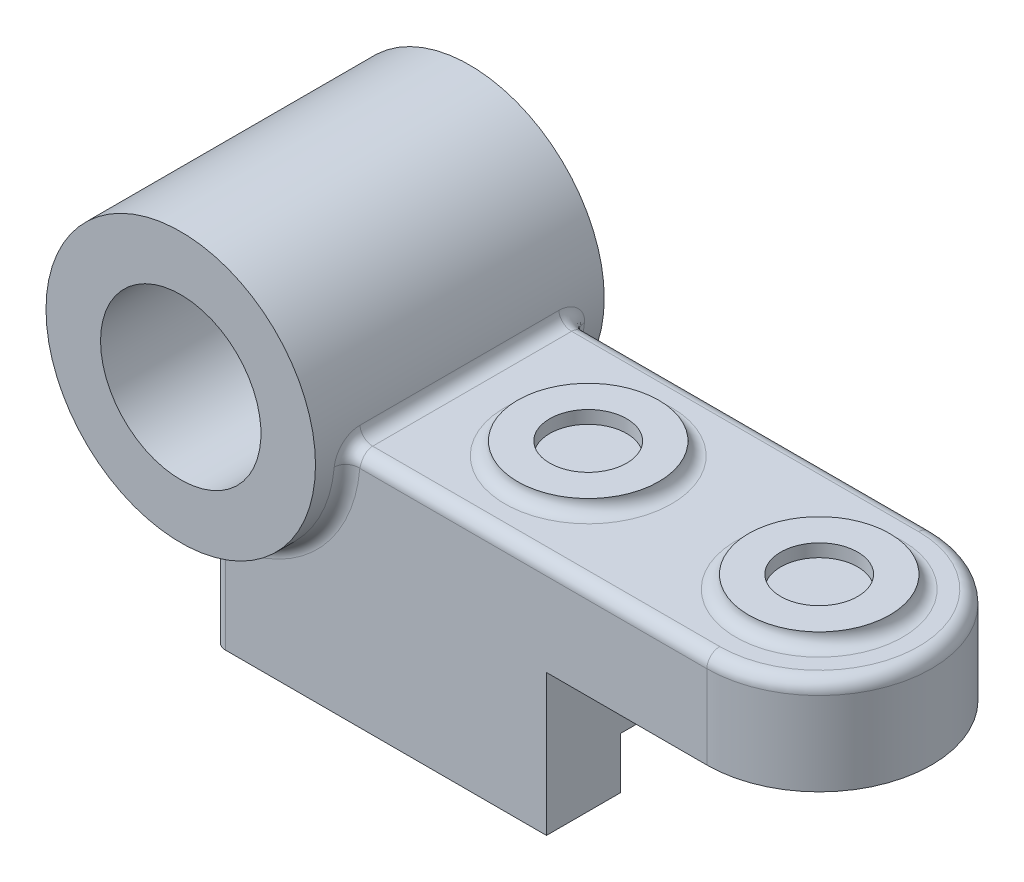
from build123d import *

# Parameters (mm, degrees)
SKETCH3_R               = 21
SKETCH3_R_2             = 12.5
BOSS_EXTRUDE1_DEPTH     = 22.5
BOSS_EXTRUDE2_DEPTH     = 17.5
CUT_EXTRUDE1_DEPTH      = 85.877853413
CUT_EXTRUDE1_DEPTH_BACK = 53
BOSS_EXTRUDE3_DEPTH     = 2
CUT_EXTRUDE2_REACH      = 121.386
FILLET1_R               = 2


with BuildPart() as part:
    # Sketch3 → Boss-Extrude1 (new, symmetric)
    with BuildSketch(Plane.XY):
        with Locations(Location((0, 0, 0), (0, 0, 180))):
            Circle(SKETCH3_R)
        with Locations(Location((0, 0, 0), (0, 0, 180))):
            Circle(SKETCH3_R_2, mode=Mode.SUBTRACT)
    extrude(amount=BOSS_EXTRUDE1_DEPTH, both=True)

    # Sketch3<3> → Boss-Extrude2 (add, symmetric)
    with BuildSketch(Plane.XY):
        with BuildLine():
            ThreePointArc((21, 0), (14.849242405, -14.849242405), (0, -21))
            Line((0, -21), (0, -37))
            Line((0, -37), (52, -37))
            Line((52, -37), (52, -15))
            Line((52, -15), (111.255819071, -15))
            Line((111.255819071, -15), (111.255819071, 0))
            Line((111.255819071, 0), (21, 0))
        make_face()
    extrude(amount=BOSS_EXTRUDE2_DEPTH, both=True)

    # Sketch5 → Cut-Extrude1 (cut, two sides: drawn at the far end of the back side and taken through both)
    with BuildSketch(Plane(origin=(52, 0, 0), x_dir=(0, 0, -1), z_dir=(1, 0, 0)).offset(-CUT_EXTRUDE1_DEPTH_BACK)):
        Polygon((6, -176.247823966), (6, -37), (6, -29), (-6, -29), (-6, -37), (-6, -176.247823966), (-6, -454.743471899), (6, -454.743471899), align=None)
    extrude(amount=CUT_EXTRUDE1_DEPTH + CUT_EXTRUDE1_DEPTH_BACK, mode=Mode.SUBTRACT)

    # Sketch4 → Boss-Extrude3 (add)
    with BuildSketch(Plane(origin=(0, 0, 0), x_dir=(1, 0, 0), z_dir=(0, 1, 0))):
        with BuildLine():
            ThreePointArc((35, 0), (41, 6), (47, 0))
            Line((47, 0), (52, 0))
            ThreePointArc((52, 0), (41, 11), (30, 0))
            Line((30, 0), (35, 0))
        make_face()
        with BuildLine():
            Line((52, 0), (47, 0))
            ThreePointArc((47, 0), (41, -6), (35, 0))
            Line((35, 0), (30, 0))
            ThreePointArc((30, 0), (41, -11), (52, 0))
        make_face()
        with BuildLine():
            ThreePointArc((88, 0), (77, 11), (66, 0))
            Line((66, 0), (71, 0))
            ThreePointArc((71, 0), (77, 6), (83, 0))
            Line((83, 0), (88, 0))
        make_face()
        with BuildLine():
            Line((71, 0), (66, 0))
            ThreePointArc((66, 0), (77, -11), (88, 0))
            Line((88, 0), (83, 0))
            ThreePointArc((83, 0), (77, -6), (71, 0))
        make_face()
    extrude(amount=BOSS_EXTRUDE3_DEPTH)

    # Sketch4<3> → Cut-Extrude2 (cut, up to next)
    with BuildSketch(Plane(origin=(0, 0, 0), x_dir=(1, 0, 0), z_dir=(0, 1, 0)), mode=Mode.PRIVATE) as cut_extrude2_sk1:
        with BuildLine():
            ThreePointArc((77, 17.5), (89.374368671, 12.374368671), (94.5, 0))
            ThreePointArc((94.5, 0), (89.374368671, -12.374368671), (77, -17.5))
            Line((77, -17.5), (111.255819071, -17.5))
            Line((111.255819071, -17.5), (111.255819071, 17.5))
            Line((111.255819071, 17.5), (77, 17.5))
        make_face()
    cut_extrude2_tool1 = extrude(cut_extrude2_sk1.sketch, amount=-CUT_EXTRUDE2_REACH, mode=Mode.PRIVATE) & part.part
    add(cut_extrude2_tool1.solids().sort_by_distance((100.628245, 0, 0))[0], mode=Mode.SUBTRACT)

    # Fillet1
    fillet1_edges = [part.edges().sort_by_distance(p)[0] for p in [
        (14.849242405, -14.849242405, 17.5),
        (21, 0, 0),
        (0, -29, -17.5),
        (0, -21, 0),
        (0, -29, 17.5),
        (14.849242405, -14.849242405, -17.5),
        (66, 0, 0),
        (30, 0, 0),
        (49, 0, -17.5),
        (49, 0, 17.5),
        (94.5, 0, 0),
    ]]
    fillet(fillet1_edges, radius=FILLET1_R - 0.0001)  # a hair under: the kernel refuses the full size


solid = part.part
